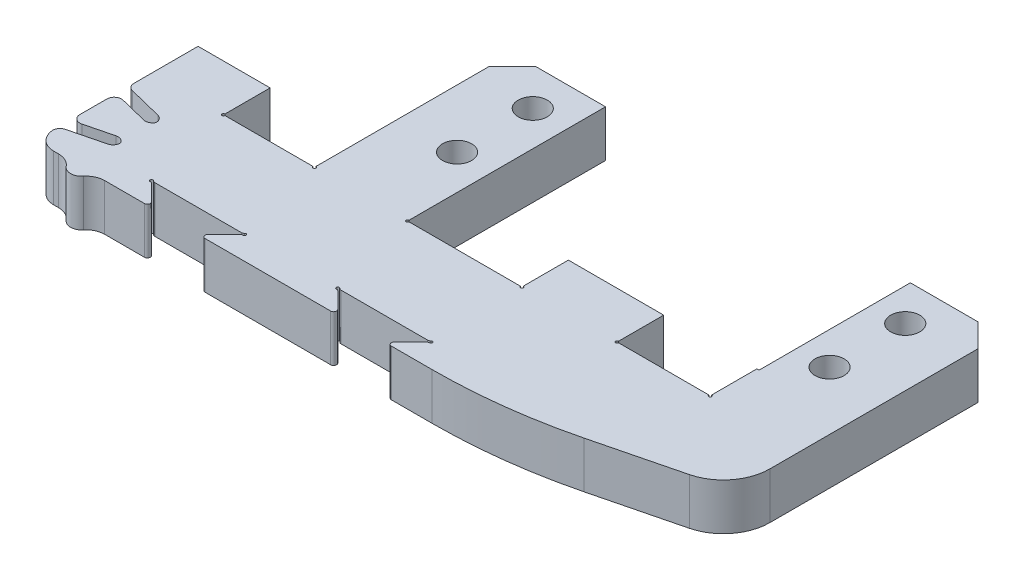
from build123d import *

# Parameters (mm, degrees)
BOSS_EXTRUDE1_DEPTH = 15.875
SKETCH3_W           = 12.7
SKETCH3_H           = 6.35
BOSS_EXTRUDE2_DEPTH = 26.9875
SKETCH5_R           = 1.5
BOSS_EXTRUDE4_DEPTH = 6.35
FILLET1_R           = 2.54
CUT_EXTRUDE1_DEPTH  = 62.570271083
FILLET3_R           = 1
CUT_EXTRUDE2_DEPTH  = 6.35
FILLET4_R           = 6.35
FILLET5_R           = 76.2
SKETCH8_W           = 9.825
SKETCH8_H           = 6.35
BOSS_EXTRUDE5_DEPTH = 6.35
SKETCH9_W           = 0.299999908
SKETCH9_H           = 20.6375
CUT_EXTRUDE3_DEPTH  = 62.570271083
FILLET6_R           = 2.54
FILLET7_R           = 2.54
SKETCH10_R          = 1.984375
CUT_EXTRUDE4_DEPTH  = 62.570271083
CHAMFER1_SIZE       = 3.175
SKETCH11_W          = 13
SKETCH11_H          = 6.35
BOSS_EXTRUDE6_DEPTH = 6.35
SKETCH12_R          = 0.1984375
CUT_EXTRUDE5_DEPTH  = 62.570271083
CUT_EXTRUDE6_DEPTH  = 6.35
FILLET8_R           = 0.396875
SKETCH14_R          = 0.1984375
CUT_EXTRUDE7_DEPTH  = 62.570271083
FILLET9_R           = 0.396875


with BuildPart() as part:
    # Sketch2 → Boss-Extrude1 (new body)
    with BuildSketch(Plane.XY):
        Polygon((51.8, -23.01875), (-33.925, -23.01875), (-33.925, -29.36875), (48.625, -29.36875), (54.975, -29.36875), (54.975, -23.01875), align=None)
    extrude(amount=BOSS_EXTRUDE1_DEPTH)

    # Sketch3 → Boss-Extrude2 (add)
    with BuildSketch(Plane(origin=(0, 0, 0), x_dir=(-1, 0, 0), z_dir=(0, 0, -1))):
        with Locations((5.35, -26.19375)):
            Rectangle(SKETCH3_W, SKETCH3_H)
        with Locations((-48.625, -26.19375)):
            Rectangle(SKETCH3_W, SKETCH3_H)
    extrude(amount=BOSS_EXTRUDE2_DEPTH)

    # Sketch5 → Boss-Extrude4 (add)
    with BuildSketch(Plane(origin=(0, -23.01875, 0), x_dir=(1, 0, 0), z_dir=(0, 1, 0))):
        with Locations((-27.575, -15.875)):
            Circle(SKETCH5_R)
    extrude(amount=-BOSS_EXTRUDE4_DEPTH)

    # Fillet1
    fillet1_edges = [part.edges().sort_by_distance(p)[0] for p in [
        (-26.075, -26.19375, 15.875),
    ]]
    fillet(fillet1_edges, radius=FILLET1_R)

    # Sketch6 → Cut-Extrude1 (cut, through all)
    with BuildSketch(Plane(origin=(0, -23.01875, 0), x_dir=(1, 0, 0), z_dir=(0, 1, 0))):
        Polygon((-33.925, -3.175), (-27.575, -4.7625), (-27.960025305, -6.302601219), (-34.310025305, -4.715101219), align=None)
        Polygon((-33.925, -12.7), (-27.575, -11.1125), (-27.960025305, -9.572398781), (-34.310025305, -11.159898781), align=None)
    extrude(amount=-CUT_EXTRUDE1_DEPTH, mode=Mode.SUBTRACT)

    # Fillet3
    # the kernel refuses this fillet: 1 mm, written as the material it adds along each edge
    with BuildSketch(Plane(origin=(-27.575, -23.01875, 11.1125), x_dir=(-0.24253562503632964, 0, -0.9701425001453328), z_dir=(0, -1, 0)), Plane(origin=(-27.960025305, -23.01875, 9.572398781), x_dir=(-0.970142500145332, 0, 0.242535625036333), z_dir=(0, -1, 0)), Plane(origin=(-27.960025305, -23.01875, 6.302601219), x_dir=(0.24253562503633191, 0, -0.9701425001453321), z_dir=(0, -1, 0)), Plane(origin=(-27.575, -23.01875, 4.7625), x_dir=(-0.9701425001453318, 0, -0.24253562503633383), z_dir=(0, -1, 0))) as fillet3_piece_1:
        with BuildLine():
            CenterArc((FILLET3_R, -FILLET3_R), FILLET3_R, 90, 90)
            Line((0, -FILLET3_R), (0, 0))
            Line((0, 0), (FILLET3_R, 0))
        make_face()
    extrude(amount=6.35)
    # the kernel refuses this fillet: 1 mm, written as the material it takes off along each edge
    with BuildSketch(Plane(origin=(-33.925, -21.066808984, 3.175), x_dir=(0, 0, -1), z_dir=(0, -1, 0)), Plane(origin=(-33.925, -21.066808984, 12.7), x_dir=(0.9701425001453319, 0, -0.24253562503633297), z_dir=(0, -1, 0))) as fillet3_2_piece_1:
        with BuildLine():
            CenterArc((FILLET3_R * 0.780776406404, FILLET3_R), FILLET3_R, 194.036243468, 75.963756532)
            Line((-FILLET3_R * 0.189366093741, FILLET3_R * 0.757464374964), (0, 0))
            Line((0, 0), (FILLET3_R * 0.780776406404, 0))
        make_face()
    extrude(amount=10.253882032, mode=Mode.SUBTRACT)
    with BuildSketch(Plane(origin=(-33.925, -32.570691016, 4.811357545), x_dir=(0.9701425001453321, 0, 0.24253562503633233), z_dir=(0, 1, 0)), Plane(origin=(-33.925, -32.570691016, 11.063642455), x_dir=(0, 0, -1), z_dir=(0, 1, 0))) as fillet3_2_piece_2:
        with BuildLine():
            CenterArc((FILLET3_R * 1.2807764064, -FILLET3_R), FILLET3_R, 90, 104.036243468)
            Line((FILLET3_R * 0.310633906259, -FILLET3_R * 1.24253562504), (0, 0))
            Line((0, 0), (FILLET3_R * 1.2807764064, 0))
        make_face()
    extrude(amount=12.753882032, mode=Mode.SUBTRACT)

    # Sketch7 → Cut-Extrude2 (cut)
    with BuildSketch(Plane(origin=(0, -29.36875, 0), x_dir=(-1, 0, 0), z_dir=(0, -1, 0))):
        Polygon((-54.975, -15.875), (-54.975, -9.525), (-29.575, -15.875), align=None)
    extrude(amount=-CUT_EXTRUDE2_DEPTH, mode=Mode.SUBTRACT)

    # Fillet4
    fillet4_edges = [part.edges().sort_by_distance(p)[0] for p in [
        (54.975, -26.19375, 9.525),
    ]]
    fillet(fillet4_edges, radius=FILLET4_R)

    # Fillet5
    fillet5_edges = [part.edges().sort_by_distance(p)[0] for p in [
        (29.575, -26.19375, 15.875),
    ]]
    fillet(fillet5_edges, radius=FILLET5_R)

    # Sketch8 → Boss-Extrude5 (add)
    with BuildSketch(Plane(origin=(0, 0, 0), x_dir=(-1, 0, 0), z_dir=(0, 0, -1))):
        with Locations((29.0125, -26.19375)):
            Rectangle(SKETCH8_W, SKETCH8_H)
    extrude(amount=BOSS_EXTRUDE5_DEPTH)

    # Sketch9 → Cut-Extrude3 (cut, through all)
    with BuildSketch(Plane(origin=(0, -23.01875, 0), x_dir=(1, 0, 0), z_dir=(0, 1, 0))):
        with Locations((42.424999954, 16.66875)):
            Rectangle(SKETCH9_W, SKETCH9_H)
    extrude(amount=-CUT_EXTRUDE3_DEPTH, mode=Mode.SUBTRACT)

    # Fillet6
    fillet6_edges = [part.edges().sort_by_distance(p)[0] for p in [
        (-29.075, -26.19375, 15.875),
    ]]
    fillet(fillet6_edges, radius=FILLET6_R)

    # Fillet7
    # the kernel refuses this fillet: 2.54 mm, written as the material it takes off along each edge
    with BuildSketch(Plane(origin=(-33.925, -16.679216678, 15.875), x_dir=(1, 0, 0), z_dir=(0, -1, 0))) as fillet7_piece_1:
        with BuildLine():
            CenterArc((2.535813329, -2.54), FILLET7_R, 90, 86.709856328)
            Line((0, -2.394223594), (-0.050716267, -2.391308065))
            ThreePointArc((-0.050716267, -2.391308065), (-0.0508, -1.197111797), (-0.0508, 0))
            Line((-0.0508, 0), (0, 0.0508))
            Line((0, 0.0508), (2.535813329, 0.0508))
            Line((2.535813329, 0.0508), (2.535813329, 0))
        make_face()
    extrude(amount=19.029066645, mode=Mode.SUBTRACT)

    # Sketch10 → Cut-Extrude4 (cut, through all)
    with BuildSketch(Plane(origin=(0, -29.36875, 0), x_dir=(-1, 0, 0), z_dir=(0, -1, 0))):
        with Locations(Location((-47.0375, 21.828125, 0), (0, 0, 180))):
            Circle(SKETCH10_R)
        with Locations(Location((-47.0375, 11.509375, 0), (0, 0, 180))):
            Circle(SKETCH10_R)
        with Locations(Location((3.7625, 11.509375, 0), (0, 0, 180))):
            Circle(SKETCH10_R)
        with Locations(Location((3.7625, 21.828125, 0), (0, 0, 180))):
            Circle(SKETCH10_R)
    extrude(amount=-CUT_EXTRUDE4_DEPTH, mode=Mode.SUBTRACT)

    # Chamfer1
    chamfer1_edges = [part.edges().sort_by_distance(p)[0] for p in [
        (54.975, -26.19375, -26.9875),
        (-11.7, -26.19375, -26.9875),
    ]]
    chamfer(chamfer1_edges, length=CHAMFER1_SIZE)

    # Sketch11 → Boss-Extrude6 (add)
    with BuildSketch(Plane(origin=(0, 0, 0), x_dir=(-1, 0, 0), z_dir=(0, 0, -1))):
        with Locations((-23.075, -26.19375)):
            Rectangle(SKETCH11_W, SKETCH11_H)
    extrude(amount=BOSS_EXTRUDE6_DEPTH)

    # Sketch12 → Cut-Extrude5 (cut, through all)
    with BuildSketch(Plane(origin=(0, -23.01875, 0), x_dir=(1, 0, 0), z_dir=(0, 1, 0))):
        with Locations((-24.1, 0)):
            Circle(SKETCH12_R)
        with Locations((-11.7, 0)):
            Circle(SKETCH12_R)
        with Locations((1, 0)):
            Circle(SKETCH12_R)
        with Locations((16.575, 0)):
            Circle(SKETCH12_R)
        with Locations((29.575, 0)):
            Circle(SKETCH12_R)
        with Locations((42.275, 0)):
            Circle(SKETCH12_R)
    extrude(amount=-CUT_EXTRUDE5_DEPTH, mode=Mode.SUBTRACT)

    # Sketch13 → Cut-Extrude6 (cut)
    with BuildSketch(Plane(origin=(0, -23.01875, 0), x_dir=(1, 0, 0), z_dir=(0, 1, 0))):
        Polygon((-21.225, -12.7), (-8.525, -12.7), (-11.7, -15.875), (-18.05, -15.875), align=None)
        Polygon((16.875, -12.7), (13.7, -15.875), (7.35, -15.875), (4.175, -12.7), align=None)
    extrude(amount=-CUT_EXTRUDE6_DEPTH, mode=Mode.SUBTRACT)

    # Fillet8
    fillet8_edges = [part.edges().sort_by_distance(p)[0] for p in [
        (-18.05, -26.19375, 15.875),
        (-11.7, -26.19375, 15.875),
        (7.35, -26.19375, 15.875),
        (13.7, -26.19375, 15.875),
    ]]
    fillet(fillet8_edges, radius=FILLET8_R)

    # Sketch14 → Cut-Extrude7 (cut, through all)
    with BuildSketch(Plane(origin=(0, -23.01875, 0), x_dir=(1, 0, 0), z_dir=(0, 1, 0))):
        with Locations((-21.225, -12.7)):
            Circle(SKETCH14_R)
        with Locations((-8.525, -12.7)):
            Circle(SKETCH14_R)
        with Locations((4.175, -12.7)):
            Circle(SKETCH14_R)
        with Locations((16.875, -12.7)):
            Circle(SKETCH14_R)
    extrude(amount=-CUT_EXTRUDE7_DEPTH, mode=Mode.SUBTRACT)

    # Fillet9
    fillet9_edges = [part.edges().sort_by_distance(p)[0] for p in [
        (-21.0265625, -26.19375, 12.7),
        (-21.084683498, -26.19375, 12.840316502),
        (-8.665316502, -26.19375, 12.840316502),
        (-8.7234375, -26.19375, 12.7),
        (4.3734375, -26.19375, 12.7),
        (4.315316502, -26.19375, 12.840316502),
        (16.734683498, -26.19375, 12.840316502),
        (16.6765625, -26.19375, 12.7),
    ]]
    fillet(fillet9_edges, radius=FILLET9_R)


solid = part.part
